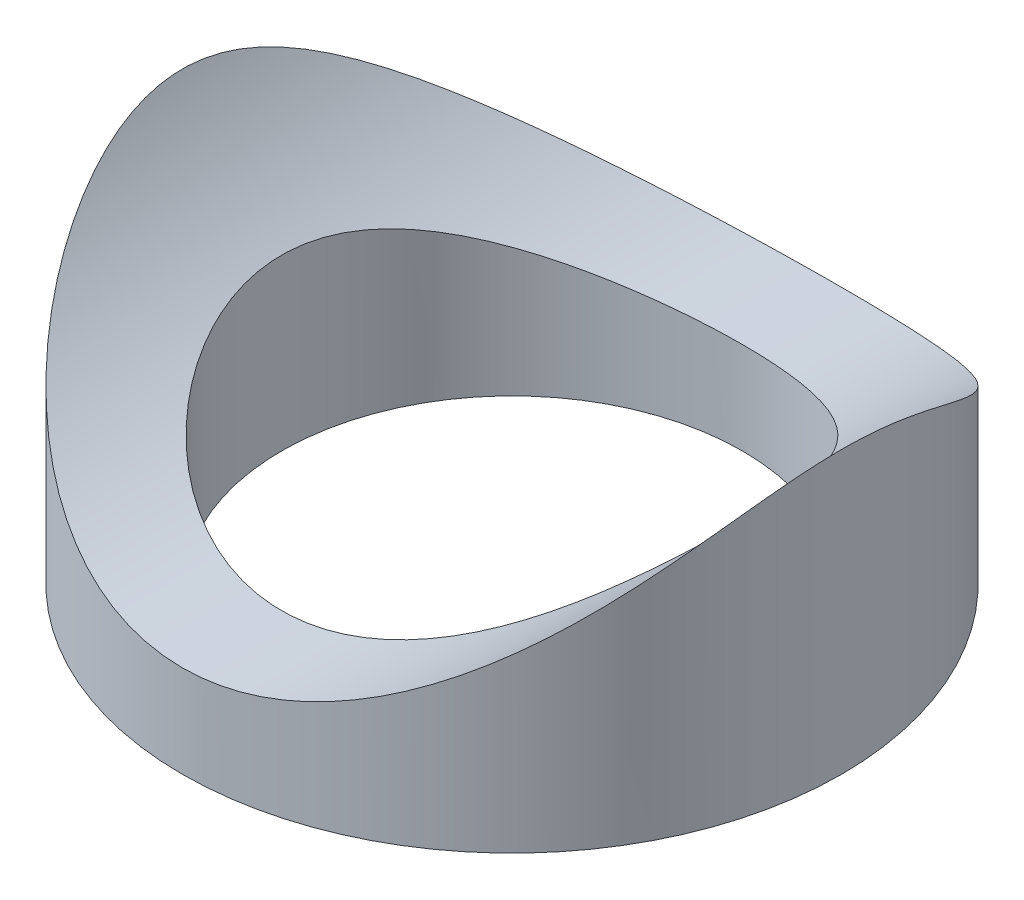
from build123d import *

# Parameters (mm, degrees)
SKETCH1_R               = 7.15
SKETCH1_R_2             = 5
BOSS_EXTRUDE1_DEPTH     = 10
CUT_EXTRUDE1_DEPTH      = 15.221286862
CUT_EXTRUDE1_DEPTH_BACK = 15.221286862
SKETCH2_R               = 8.28
BOSS_EXTRUDE2_START     = 1
SKETCH3_R               = 7.15
SKETCH3_R_2             = 5
BOSS_EXTRUDE2_DEPTH     = 1


with BuildPart() as part:
    # Sketch1 → Boss-Extrude1 (new body)
    with BuildSketch(Plane(origin=(0, 0, 0), x_dir=(1, 0, 0), z_dir=(0, 1, 0))):
        Circle(SKETCH1_R)
        Circle(SKETCH1_R_2, mode=Mode.SUBTRACT)
    extrude(amount=BOSS_EXTRUDE1_DEPTH)

    # Sketch2 → Cut-Extrude1 (cut, two sides: drawn at the far end of the back side and taken through both)
    with BuildSketch(Plane.XY.offset(-CUT_EXTRUDE1_DEPTH_BACK)):
        with Locations((0, 9.28)):
            Circle(SKETCH2_R)
    extrude(amount=CUT_EXTRUDE1_DEPTH + CUT_EXTRUDE1_DEPTH_BACK, mode=Mode.SUBTRACT)

    # Sketch3 → Boss-Extrude2 (add)
    with BuildSketch(Plane.XZ.offset(BOSS_EXTRUDE2_START)):
        Circle(SKETCH3_R)
        Circle(SKETCH3_R_2, mode=Mode.SUBTRACT)
    extrude(amount=-BOSS_EXTRUDE2_DEPTH)


solid = part.part
